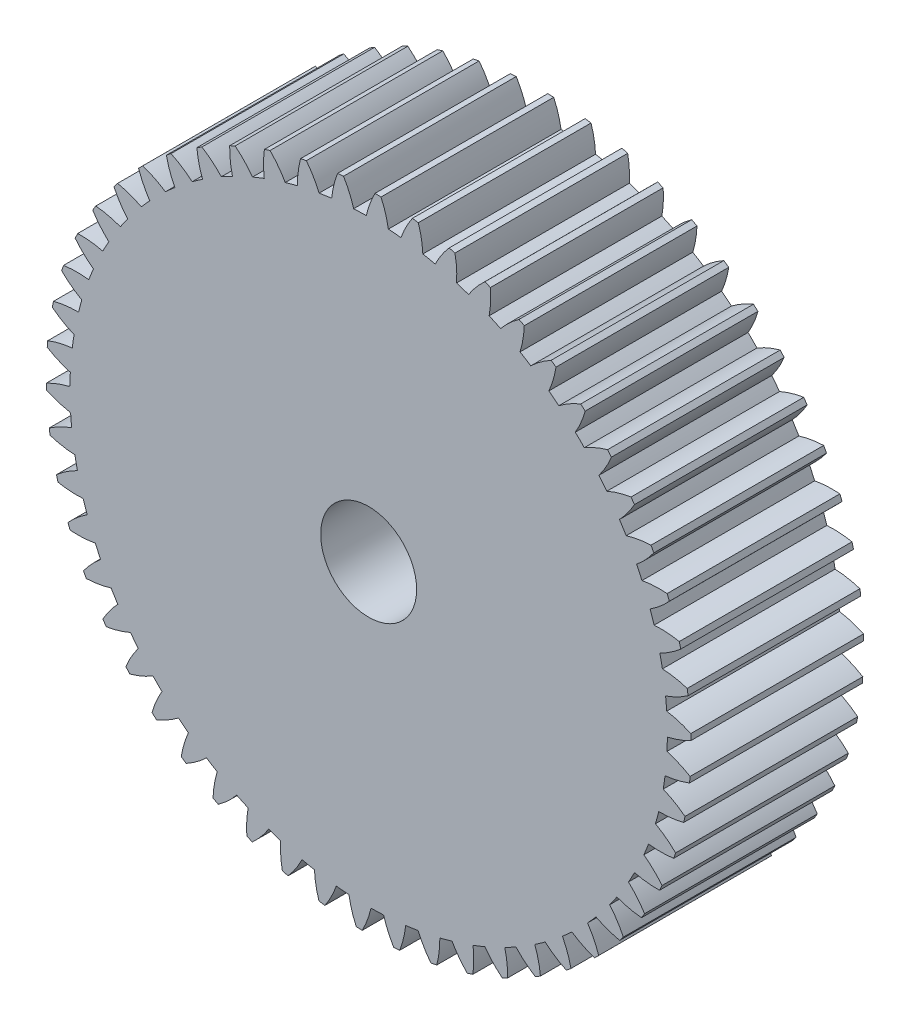
from build123d import *

# Parameters (mm, degrees)
BOSS_EXTRUDE3_DEPTH = 45
SKETCH2_R           = 77.825472222
BOSS_EXTRUDE4_DEPTH = 45
FILLET1_R           = 0.5
FILLET3_R           = 0.5
CIRPATTERN1_COUNT   = 54
SKETCH6_R           = 12.5
CUT_EXTRUDE1_DEPTH  = 45


with BuildPart() as part:
    # Sketch5 → Boss-Extrude3 (new body)
    with BuildSketch(Plane.XY):
        with BuildLine():
            ThreePointArc((-77.823045268, 0.614615186), (-80.979046014, -0.32058055), (-83.983491314, -1.665288777))
            ThreePointArc((-83.983491314, -1.665288777), (-83.964463807, -2.443116374), (-83.93823247, -3.220734362))
            ThreePointArc((-83.93823247, -3.220734362), (-80.860682386, -4.388474598), (-77.655644298, -5.138583007))
            ThreePointArc((-77.655644298, -5.138583007), (-77.792548163, -2.263531971), (-77.823045268, 0.614615186))
        make_face()
    boss_extrude3 = extrude(amount=BOSS_EXTRUDE3_DEPTH)

    # Sketch2 → Boss-Extrude4 (add)
    with BuildSketch(Plane.XY):
        Circle(SKETCH2_R)
    extrude(amount=BOSS_EXTRUDE4_DEPTH)

    # Fillet1
    fillet1_edges = [part.edges().sort_by_distance(p)[0] for p in [
        (-77.823045268, 0.614615186, 22.5),
    ]]
    fillet(fillet1_edges, radius=FILLET1_R)

    # Fillet3
    fillet3_edges = [part.edges().sort_by_distance(p)[0] for p in [
        (-77.655644298, -5.138583007, 22.5),
    ]]
    fillet(fillet3_edges, radius=FILLET3_R)

    # CirPattern1: Boss-Extrude3 ×54 about axis
    cirpattern1_axis = Axis((0, 0, 0), (0, 0, 1))
    for i in range(1, CIRPATTERN1_COUNT):
        add(boss_extrude3.rotate(cirpattern1_axis, i * 360 / CIRPATTERN1_COUNT))

    # Sketch6 → Cut-Extrude1 (cut)
    with BuildSketch(Plane.XY.offset(45)):
        Circle(SKETCH6_R)
    extrude(amount=-CUT_EXTRUDE1_DEPTH, mode=Mode.SUBTRACT)


solid = part.part
